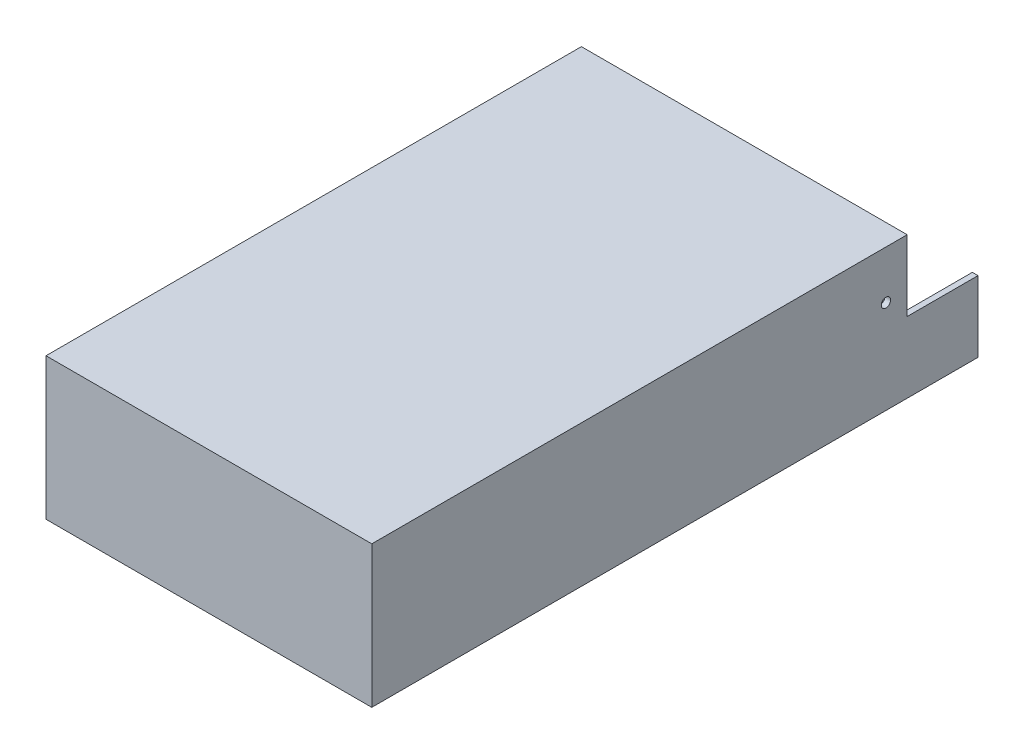
from build123d import *

# Parameters (mm, degrees)
SKETCH1_W                = 115
SKETCH1_H                = 214
BOSS_EXTRUDE1_DEPTH      = 50
SKETCH4_W                = 25
SKETCH4_H                = 25
CUT_EXTRUDE1_DEPTH       = 249.034271825
SHELL1_START             = 2
SHELL1_OUTLINE_W         = 111
SHELL1_OUTLINE_H         = 185
SHELL1_DEPTH             = 46
SHELL1_2_OUTLINE_W       = 111
SHELL1_2_OUTLINE_H       = 27
SHELL1_2_DEPTH           = 23
M4_CLEARANCE_HOLE1_D     = 4.3
M4_CLEARANCE_HOLE1_DEPTH = 4
M4_CLEARANCE_HOLE1_TIP   = 1.291850331
TAP_DRILL_FOR_M4_TAP1_D  = 3.3


# Read off the part's stored shape, not the designer's step: Shell1
with BuildPart() as part:
    # Sketch1 → Boss-Extrude1 (new body)
    with BuildSketch(Plane(origin=(0, 0, 0), x_dir=(1, 0, 0), z_dir=(0, 1, 0))):
        with Locations((57.5, 107)):
            Rectangle(SKETCH1_W, SKETCH1_H)
    extrude(amount=BOSS_EXTRUDE1_DEPTH)

    # Sketch4 → Cut-Extrude1 (cut, through all)
    with BuildSketch(Plane(origin=(115, 0, 0), x_dir=(0, 0, -1), z_dir=(1, 0, 0))):
        with Locations((201.5, 37.5)):
            Rectangle(SKETCH4_W, SKETCH4_H)
    extrude(amount=-CUT_EXTRUDE1_DEPTH, mode=Mode.SUBTRACT)

    # Shell1 outline → Shell1 (cut)
    with BuildSketch(Plane(origin=(0, 0, 0), x_dir=(1, 0, 0), z_dir=(0, 1, 0)).offset(SHELL1_START)):
        with Locations((57.5, 94.5)):
            Rectangle(SHELL1_OUTLINE_W, SHELL1_OUTLINE_H)
    extrude(amount=SHELL1_DEPTH, mode=Mode.SUBTRACT)

    # Shell1 2 outline → Shell1 2 (cut)
    with BuildSketch(Plane(origin=(0, 0, 0), x_dir=(1, 0, 0), z_dir=(0, 1, 0)).offset(SHELL1_START)):
        with Locations((57.5, 200.5)):
            Rectangle(SHELL1_2_OUTLINE_W, SHELL1_2_OUTLINE_H)
    extrude(amount=SHELL1_2_DEPTH, mode=Mode.SUBTRACT)

    # M4 Clearance Hole1
    with Locations(Plane(origin=(0, 0, 0), x_dir=(-1, 0, 0), z_dir=(0, -1, 0))):
        with Locations((-32.5, 32), (-57.5, 107), (-32.5, 182), (-82.5, 32), (-82.5, 182)):
            Hole(M4_CLEARANCE_HOLE1_D / 2, depth=M4_CLEARANCE_HOLE1_DEPTH)
            with Locations((0, 0, -(M4_CLEARANCE_HOLE1_DEPTH + M4_CLEARANCE_HOLE1_TIP / 2))):  # 118° drill point
                Cone(0, M4_CLEARANCE_HOLE1_D / 2, M4_CLEARANCE_HOLE1_TIP, mode=Mode.SUBTRACT)

    # Tap Drill for M4 Tap1 (through all)
    with Locations(Plane(origin=(115, 0, 0), x_dir=(0, 0, -1), z_dir=(1, 0, 0))):
        with Locations((181.5, 33)):
            Hole(TAP_DRILL_FOR_M4_TAP1_D / 2)


solid = part.part
